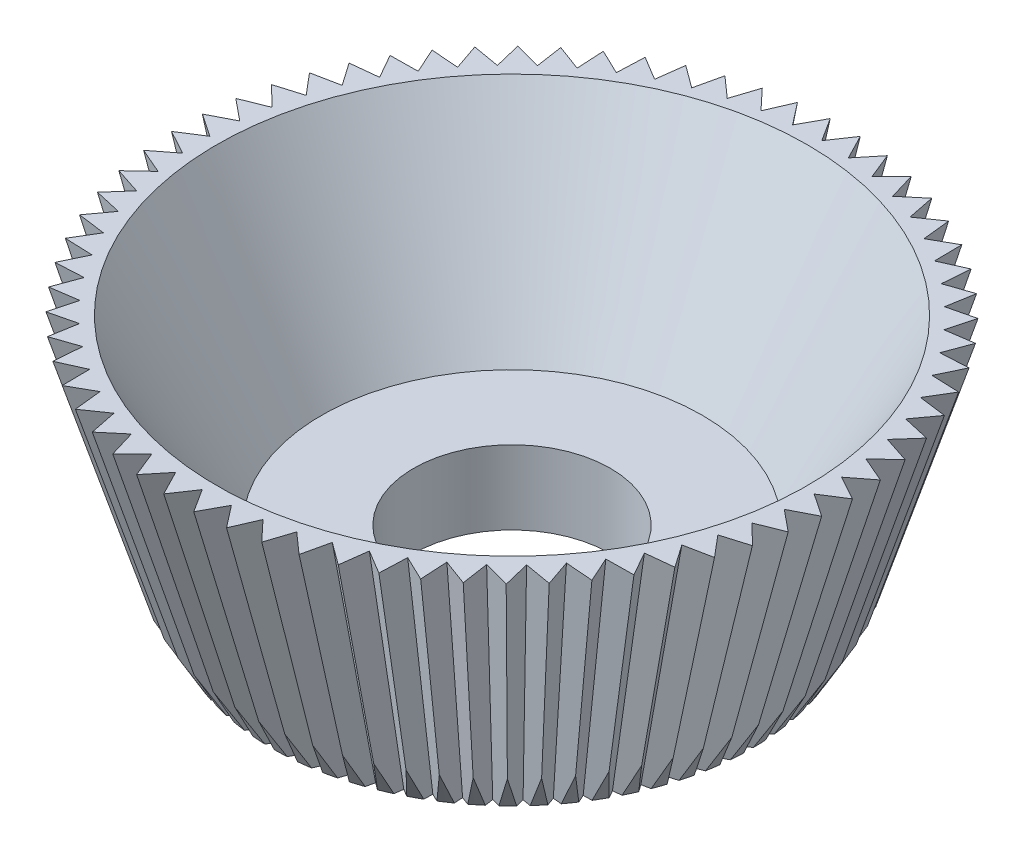
from build123d import *

# Parameters (mm, degrees)
CUT_EXTRUDE1_DEPTH = 12.17959231
CUT_EXTRUDE1_TAPER = -9
CIRPATTERN1_COUNT  = 68


with BuildPart() as part:
    # Sketch1 → Revolve1 (revolve)
    with BuildSketch(Plane.XY):
        Polygon((4.866954203, 9.805456304), (7, 13.5), (7, 15), (6, 15), (3.866954203, 11.305456304), (2, 11.305456304), (2, 9.805456304), align=None)
    revolve(axis=Axis((0, 9.805456304, 0), (0, 1, 0)))

    # Sketch2 → Cut-Extrude1 (cut, through all)
    with BuildSketch(Plane(origin=(0, 15, 0), x_dir=(1, 0, 0), z_dir=(0, 1, 0))):
        with BuildLine():
            ThreePointArc((0.057474451, -6.999764045), (0.55891124, -6.97765134), (1.057474451, -6.919663849))
            Line((1.057474451, -6.919663849), (0.496423012, -6.197525561))
            Line((0.496423012, -6.197525561), (0.057474451, -6.999764045))
        make_face()
    cut_extrude1 = extrude(amount=-CUT_EXTRUDE1_DEPTH, taper=CUT_EXTRUDE1_TAPER, mode=Mode.SUBTRACT)

    # CirPattern1: Cut-Extrude1 ×68 about axis
    cirpattern1_axis = Axis((0, 15, 0), (0, -1, 0))
    for i in range(1, CIRPATTERN1_COUNT):
        add(cut_extrude1.rotate(cirpattern1_axis, i * 360 / CIRPATTERN1_COUNT), mode=Mode.SUBTRACT)


solid = part.part
